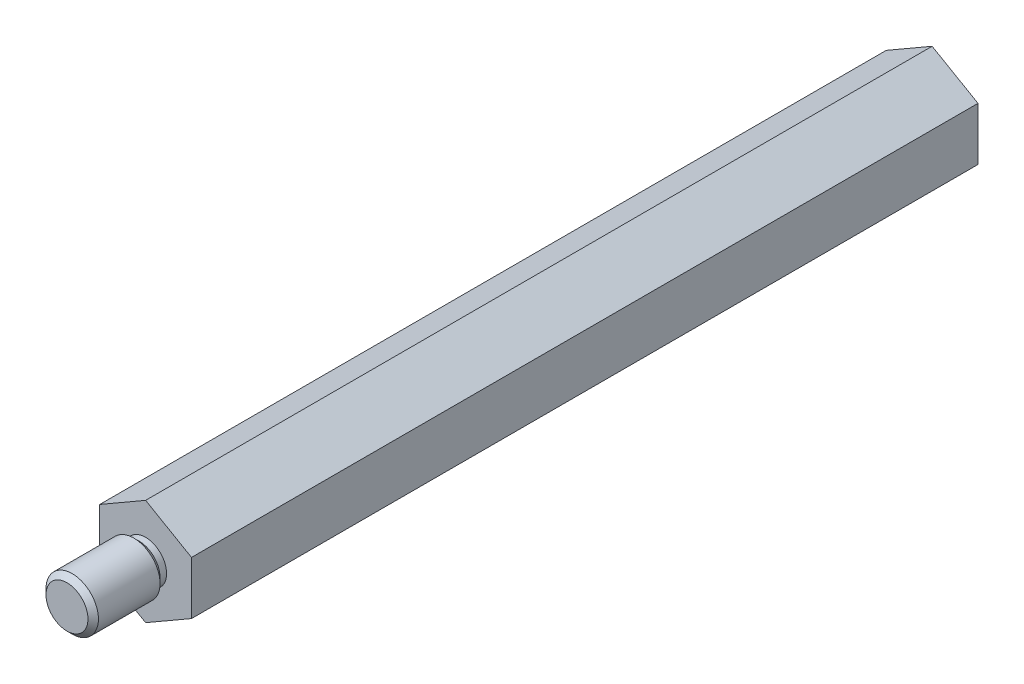
from build123d import *

# Parameters (mm, degrees)
EXTRUDE_1_DEPTH             = 60
SKETCH_2_R                  = 2
EXTRUDE_2_DEPTH             = 6
SKETCH_3_R                  = 2
SKETCH_3_R_2                = 1.6
CUT_EXTRUDE_3_DEPTH         = 0.5
CHAMFER_1_SIZE              = 0.4
HOLE_WIZARD_M31_D           = 3.2
HOLE_WIZARD_M31_DEPTH       = 10
HOLE_WIZARD_M31_CSINK_D     = 4
HOLE_WIZARD_M31_CSINK_ANGLE = 90
HOLE_WIZARD_M31_TIP         = 0.96137699


with BuildPart() as part:
    # Эскиз1 → Вытянуть1 (new body)
    with BuildSketch(Plane.XY):
        Polygon((0, 4.041451884), (-3.5, 2.020725942), (-3.5, -2.020725942), (0, -4.041451884), (3.5, -2.020725942), (3.5, 2.020725942), align=None)
    extrude(amount=EXTRUDE_1_DEPTH)

    # Эскиз2 → Вытянуть2 (add)
    with BuildSketch(Plane.XY.offset(60)):
        Circle(SKETCH_2_R)
    extrude(amount=EXTRUDE_2_DEPTH)

    # Эскиз3 → Вырез-Вытянуть3 (cut)
    with BuildSketch(Plane.XY.offset(60)):
        Circle(SKETCH_3_R)
        Circle(SKETCH_3_R_2, mode=Mode.SUBTRACT)
    extrude(amount=CUT_EXTRUDE_3_DEPTH, mode=Mode.SUBTRACT)

    # Фаска1
    chamfer_1_edges = [part.edges().sort_by_distance(p)[0] for p in [
        (-2, 0, 66),
        (-2, 0, 60.5),
    ]]
    chamfer(chamfer_1_edges, length=CHAMFER_1_SIZE - 0.0001)  # a hair under: the kernel refuses the full size

    # Отверстие с зазором M31
    with Locations(Plane(origin=(0, 0, 0), x_dir=(-1, 0, 0), z_dir=(0, 0, -1))):
        with Locations((0, 0)):
            CounterSinkHole(HOLE_WIZARD_M31_D / 2, HOLE_WIZARD_M31_CSINK_D / 2, depth=HOLE_WIZARD_M31_DEPTH, counter_sink_angle=HOLE_WIZARD_M31_CSINK_ANGLE)
            with Locations((0, 0, -(HOLE_WIZARD_M31_DEPTH + HOLE_WIZARD_M31_TIP / 2))):  # 118° drill point
                Cone(0, HOLE_WIZARD_M31_D / 2, HOLE_WIZARD_M31_TIP, mode=Mode.SUBTRACT)


solid = part.part
